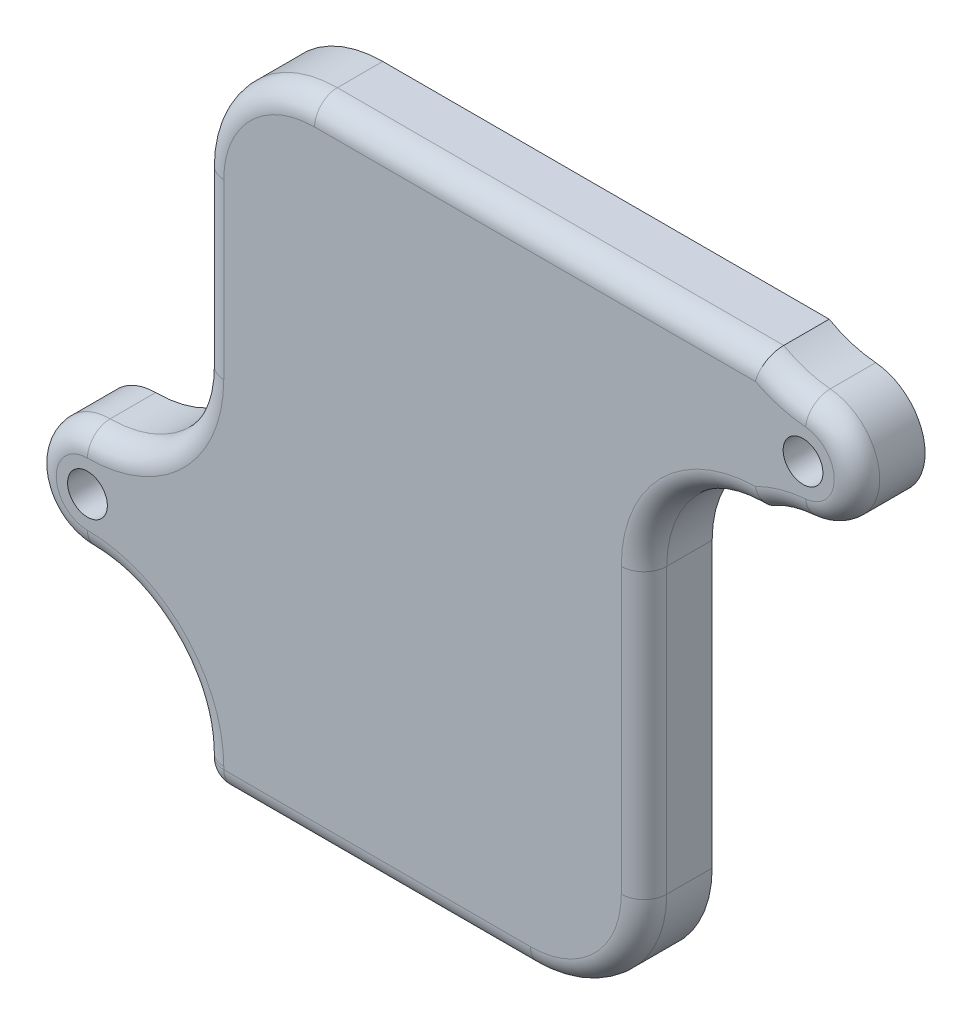
from build123d import *

# Parameters (mm, degrees)
SKETCH1_W           = 39
SKETCH1_H           = 57
BOSS_EXTRUDE1_DEPTH = 6
SKETCH2_R           = 4.75
SKETCH2_R_2         = 1.75
BOSS_EXTRUDE2_DEPTH = 6
FILLET4_R           = 10
SKETCH4_W           = 10.304705379
SKETCH4_H           = 12
BOSS_EXTRUDE3_DEPTH = 6
FILLET5_R           = 10
CUT_EXTRUDE2_DEPTH  = 3.5
FILLET7_R           = 2
FILLET8_R           = 2
FILLET9_R           = 2


with BuildPart() as part:
    # Sketch1 → Boss-Extrude1 (new body)
    with BuildSketch(Plane.XY):
        Rectangle(SKETCH1_W, SKETCH1_H)
    extrude(amount=BOSS_EXTRUDE1_DEPTH)

    # Sketch2 → Boss-Extrude2 (add)
    # profile 1 of 4: a face of its own
    with BuildSketch(Plane.XY.offset(6)):
        with BuildLine():
            ThreePointArc((33.5, 17.75), (28.75, 22.5), (33.5, 27.25))
            Line((33.5, 27.25), (19.5, 27.25))
            Line((19.5, 27.25), (19.5, 17.75))
            Line((19.5, 17.75), (33.5, 17.75))
        make_face()
    # profile 2 of 4: a face of its own
    with BuildSketch(Plane.XY.offset(6)):
        with BuildLine():
            Line((-19.5, -6.75), (-29.5, -6.75))
            ThreePointArc((-29.5, -6.75), (-26.141242789, -8.141242789), (-24.75, -11.5))
            ThreePointArc((-24.75, -11.5), (-26.141242789, -14.858757211), (-29.5, -16.25))
            Line((-29.5, -16.25), (-19.5, -16.25))
            Line((-19.5, -16.25), (-19.5, -6.75))
        make_face()
    # profile 3 of 4: a face of its own
    with BuildSketch(Plane.XY.offset(6)):
        with Locations((-29.5, -11.5)):
            Circle(SKETCH2_R)
        with Locations((-29.5, -11.5)):
            Circle(SKETCH2_R_2, mode=Mode.SUBTRACT)
    # profile 4 of 4: a face of its own
    with BuildSketch(Plane.XY.offset(6)):
        with Locations((33.5, 22.5)):
            Circle(SKETCH2_R)
        with Locations((33.5, 22.5)):
            Circle(SKETCH2_R_2, mode=Mode.SUBTRACT)
    extrude(amount=-BOSS_EXTRUDE2_DEPTH)

    # Fillet4
    fillet4_edges = [part.edges().sort_by_distance(p)[0] for p in [
        (-19.5, 28.5, 3),
        (19.5, -28.5, 3),
    ]]
    fillet(fillet4_edges, radius=FILLET4_R)

    # Sketch4 → Boss-Extrude3 (add)
    with BuildSketch(Plane.XY.offset(6)):
        with Locations((24.652352689, 22.5)):
            Rectangle(SKETCH4_W, SKETCH4_H)
    extrude(amount=-BOSS_EXTRUDE3_DEPTH)

    # Fillet5
    # the kernel refuses this fillet: 10 mm, written as the material it adds along each edge
    with BuildSketch(Plane(origin=(29.804705379, 17.75, 6), x_dir=(0, -1, 0), z_dir=(0, 0, -1))) as fillet5_piece_1:
        with BuildLine():
            CenterArc((9.947871925, -4.934270359), FILLET5_R, 150.433919307, 24.747651836)
            Line((-0.016787007, -4.094286808), (-1.0132529, -4.010288453))
            ThreePointArc((-1.0132529, -4.010288453), (-1, -3.695294621), (-1, 0))
            Line((-1, 0), (0, 1))
            ThreePointArc((0, 1), (0.625, 1), (0.380212808, 0.493427036))
            Line((0.380212808, 0.493427036), (1.25, 0))
        make_face()
    extrude(amount=6)
    with BuildSketch(Plane(origin=(29.804705379, 27.25, 0), x_dir=(0.9999915946740242, -0.004100070889875189, 0), z_dir=(0, 0, 1))) as fillet5_piece_2:
        with BuildLine():
            CenterArc((4.893441905, 9.968019168), FILLET5_R, 240.668836723, 24.747651836)
            Line((-0.005125089, 1.249989493), (-0.494981788, 0.378186526))
            ThreePointArc((-0.494981788, 0.378186526), (-1.002554139, 0.620894676), (-0.999991595, -0.004100071))
            Line((-0.999991595, -0.004100071), (0.004100071, -0.999991595))
            ThreePointArc((0.004100071, -0.999991595), (3.699363631, -0.984840625), (4.014409153, -0.996801917))
            Line((4.014409153, -0.996801917), (4.094321222, 0))
        make_face()
    extrude(amount=6)
    with BuildSketch(Plane(origin=(19.5, 16.5, 6), x_dir=(0, -1, 0), z_dir=(0, 0, -1)), Plane(origin=(-19.5, -6.75, 6), x_dir=(0, 1, 0), z_dir=(0, 0, -1)), Plane(origin=(-19.5, -16.25, 6), x_dir=(-1, 0, 0), z_dir=(0, 0, -1))) as fillet5_piece_3:
        with BuildLine():
            CenterArc((FILLET5_R, -FILLET5_R), FILLET5_R, 90, 90)
            Line((0, -FILLET5_R), (-FILLET5_R * 0.02, -FILLET5_R))
            Line((-FILLET5_R * 0.02, -FILLET5_R), (-FILLET5_R * 0.02, FILLET5_R * 0.02))
            Line((-FILLET5_R * 0.02, FILLET5_R * 0.02), (FILLET5_R, FILLET5_R * 0.02))
            Line((FILLET5_R, FILLET5_R * 0.02), (FILLET5_R, 0))
        make_face()
    extrude(amount=6)

    # Sketch5 → Cut-Extrude2 (cut)
    with BuildSketch(Plane(origin=(0, 0, 0), x_dir=(-1, 0, 0), z_dir=(0, 0, -1))):
        with BuildLine():
            Line((16.5, 3.25), (16.5, 18.5))
            ThreePointArc((16.5, 18.5), (14.449747468, 23.449747468), (9.5, 25.5))
            Line((9.5, 25.5), (-20.150604469, 25.5))
            Line((-20.150604469, 25.5), (-20.150604469, 15.532652058))
            ThreePointArc((-20.150604469, 15.532652058), (-17.447155068, 11.371234859), (-16.5, 6.5))
            Line((-16.5, 6.5), (-16.5, -18.5))
            ThreePointArc((-16.5, -18.5), (-14.449747468, -23.449747468), (-9.5, -25.5))
            Line((-9.5, -25.5), (16.521652648, -25.5))
            ThreePointArc((16.521652648, -25.5), (17.716131688, -20.759968343), (20.576715851, -16.796164799))
            Line((20.576715851, -16.796164799), (20.307611845, -5.942388155))
            ThreePointArc((20.307611845, -5.942388155), (17.489566077, -1.724884621), (16.5, 3.25))
        make_face()
    extrude(amount=-CUT_EXTRUDE2_DEPTH, mode=Mode.SUBTRACT)

    # Fillet7
    fillet7_edges = [part.edges().sort_by_distance(p)[0] for p in [
        (-19.5, -28.5, 3),
    ]]
    fillet(fillet7_edges, radius=FILLET7_R)

    # Fillet8
    # the kernel refuses this fillet: 2 mm, written as the material it takes off along each edge
    with BuildSketch(Plane(origin=(34.738975739, 7.802128075, 6), x_dir=(-0.8500291529283407, 0.5267356444858536, 0), z_dir=(-0.5267356444858536, -0.8500291529283407, 0))) as fillet8_piece_1:
        with BuildLine():
            CenterArc((10 + FILLET8_R, FILLET8_R), FILLET8_R, 180, 90)
            Line((10, FILLET8_R), (10, 0))
            Line((10, 0), (10 + FILLET8_R, 0))
        make_face()
    revolve(axis=Axis((34.738975739, 7.802128075, 6), (0, 0, -1)), revolution_arc=53.396411501, mode=Mode.SUBTRACT)
    with BuildSketch(Plane(origin=(34.738975739, 37.197871925, 6), x_dir=(-0.8500291529284019, -0.5267356444857548, 0), z_dir=(-0.5267356444857548, 0.8500291529284019, 0))) as fillet8_piece_2:
        with BuildLine():
            CenterArc((10 + FILLET8_R, -FILLET8_R), FILLET8_R, 90, 90)
            Line((10, -FILLET8_R), (10, 0))
            Line((10, 0), (10 + FILLET8_R, 0))
        make_face()
    revolve(axis=Axis((34.738975739, 37.197871925, 6), (0, 0, 1)), revolution_arc=53.396411501, mode=Mode.SUBTRACT)
    with BuildSketch(Plane(origin=(29.5, 6.5, 6), x_dir=(-1, 0, 0), z_dir=(0, -1, 0))) as fillet8_piece_3:
        with BuildLine():
            CenterArc((10 + FILLET8_R, FILLET8_R), FILLET8_R, 180, 90)
            Line((10, FILLET8_R), (10, 0))
            Line((10, 0), (10 + FILLET8_R, 0))
        make_face()
    revolve(axis=Axis((29.5, 6.5, 6), (0, 0, -1)), revolution_arc=90, mode=Mode.SUBTRACT)
    with BuildSketch(Plane(origin=(19.5, -18.5, 6), x_dir=(-1, 0, 0), z_dir=(0, 1, 0))) as fillet8_piece_4:
        with BuildLine():
            CenterArc((FILLET8_R, -FILLET8_R), FILLET8_R, 90, 90)
            Line((0, -FILLET8_R), (0, 0))
            Line((0, 0), (FILLET8_R, 0))
        make_face()
    extrude(amount=25, mode=Mode.SUBTRACT)
    with BuildSketch(Plane(origin=(9.5, -18.5, 6), x_dir=(0, -1, 0), z_dir=(-1, 0, 0))) as fillet8_piece_5:
        with BuildLine():
            CenterArc((10 - FILLET8_R, -FILLET8_R), FILLET8_R, 0, 90)
            Line((10, -FILLET8_R), (10, 0))
            Line((10, 0), (10 - FILLET8_R, 0))
        make_face()
    revolve(axis=Axis((9.5, -18.5, 6), (0, 0, 1)), revolution_arc=90, mode=Mode.SUBTRACT)
    with BuildSketch(Plane(origin=(-17.5, -28.5, 6), x_dir=(0, 1, 0), z_dir=(1, 0, 0))) as fillet8_piece_6:
        with BuildLine():
            CenterArc((FILLET8_R, -FILLET8_R), FILLET8_R, 90, 90)
            Line((0, -FILLET8_R), (0, 0))
            Line((0, 0), (FILLET8_R, 0))
        make_face()
    extrude(amount=27, mode=Mode.SUBTRACT)
    with BuildSketch(Plane(origin=(-17.5, -26.5, 6), x_dir=(-1, 0, 0), z_dir=(0, 1, 0))) as fillet8_piece_7:
        with BuildLine():
            CenterArc((2 - FILLET8_R, -FILLET8_R), FILLET8_R, 0, 90)
            Line((2, -FILLET8_R), (2, 0))
            Line((2, 0), (2 - FILLET8_R, 0))
        make_face()
    revolve(axis=Axis((-17.5, -26.5, 6), (0, 0, 1)), revolution_arc=90, mode=Mode.SUBTRACT)
    with BuildSketch(Plane(origin=(-19.5, -26.25, 6), x_dir=(1, 0, 0), z_dir=(0, -1, 0))) as fillet8_piece_8:
        with BuildLine():
            CenterArc((FILLET8_R, -FILLET8_R), FILLET8_R, 90, 90)
            Line((0, -FILLET8_R), (0, 0))
            Line((0, 0), (FILLET8_R, 0))
        make_face()
    extrude(amount=0.25, mode=Mode.SUBTRACT)
    with BuildSketch(Plane(origin=(-29.5, -26.25, 6), x_dir=(0, 1, 0), z_dir=(-1, 0, 0))) as fillet8_piece_9:
        with BuildLine():
            CenterArc((10 + FILLET8_R, FILLET8_R), FILLET8_R, 180, 90)
            Line((10, FILLET8_R), (10, 0))
            Line((10, 0), (10 + FILLET8_R, 0))
        make_face()
    revolve(axis=Axis((-29.5, -26.25, 6), (0, 0, -1)), revolution_arc=90, mode=Mode.SUBTRACT)
    with BuildSketch(Plane(origin=(-29.5, -11.5, 6), x_dir=(0, 1, 0), z_dir=(1, 0, 0))) as fillet8_piece_10:
        with BuildLine():
            CenterArc((4.75 - FILLET8_R, -FILLET8_R), FILLET8_R, 0, 90)
            Line((4.75, -FILLET8_R), (4.75, 0))
            Line((4.75, 0), (4.75 - FILLET8_R, 0))
        make_face()
    revolve(axis=Axis((-29.5, -11.5, 6), (0, 0, 1)), revolution_arc=180, mode=Mode.SUBTRACT)
    with BuildSketch(Plane(origin=(-29.5, 3.25, 6), x_dir=(1, 0, 0), z_dir=(0, 1, 0))) as fillet8_piece_11:
        with BuildLine():
            CenterArc((10 + FILLET8_R, FILLET8_R), FILLET8_R, 180, 90)
            Line((10, FILLET8_R), (10, 0))
            Line((10, 0), (10 + FILLET8_R, 0))
        make_face()
    revolve(axis=Axis((-29.5, 3.25, 6), (0, 0, -1)), revolution_arc=90, mode=Mode.SUBTRACT)
    with BuildSketch(Plane(origin=(-19.5, 18.5, 6), x_dir=(1, 0, 0), z_dir=(0, -1, 0))) as fillet8_piece_12:
        with BuildLine():
            CenterArc((FILLET8_R, -FILLET8_R), FILLET8_R, 90, 90)
            Line((0, -FILLET8_R), (0, 0))
            Line((0, 0), (FILLET8_R, 0))
        make_face()
    extrude(amount=15.25, mode=Mode.SUBTRACT)
    with BuildSketch(Plane(origin=(-9.5, 18.5, 6), x_dir=(0, 1, 0), z_dir=(1, 0, 0))) as fillet8_piece_13:
        with BuildLine():
            CenterArc((10 - FILLET8_R, -FILLET8_R), FILLET8_R, 0, 90)
            Line((10, -FILLET8_R), (10, 0))
            Line((10, 0), (10 - FILLET8_R, 0))
        make_face()
    revolve(axis=Axis((-9.5, 18.5, 6), (0, 0, 1)), revolution_arc=90, mode=Mode.SUBTRACT)
    with BuildSketch(Plane(origin=(33.5, 22.5, 6), x_dir=(0.08399835516458835, 0.9964658932094184, 0), z_dir=(-0.9964658932094184, 0.08399835516458835, 0))) as fillet8_piece_14:
        with BuildLine():
            CenterArc((4.75 - FILLET8_R, FILLET8_R), FILLET8_R, 270, 90)
            Line((4.75, FILLET8_R), (4.75, 0))
            Line((4.75, 0), (4.75 - FILLET8_R, 0))
        make_face()
    revolve(axis=Axis((33.5, 22.5, 6), (0, 0, -1)), revolution_arc=170.363142288, mode=Mode.SUBTRACT)
    with BuildSketch(Plane(origin=(-9.5, 28.5, 6), x_dir=(0, -1, 0), z_dir=(1, 0, 0))) as fillet8_piece_15:
        with BuildLine():
            CenterArc((FILLET8_R, FILLET8_R), FILLET8_R, 180, 90)
            Line((0, FILLET8_R), (0, 0))
            Line((0, 0), (FILLET8_R, 0))
        make_face()
    extrude(amount=44.304705379, mode=Mode.SUBTRACT)
    with BuildSketch(Plane(origin=(34.804705379, 16.5, 6), x_dir=(0, 1, 0), z_dir=(-1, 0, 0))) as fillet8_piece_16:
        with BuildLine():
            CenterArc((FILLET8_R, FILLET8_R), FILLET8_R, 180, 90)
            Line((0, FILLET8_R), (0, 0))
            Line((0, 0), (FILLET8_R, 0))
        make_face()
    extrude(amount=5.304705379, mode=Mode.SUBTRACT)

    # Fillet9
    fillet9_edges = [part.edges().sort_by_distance(p)[0] for p in [
        (-16.5, 10.875, 3.5),
        (-3.510826324, -25.5, 3.5),
        (14.449747468, -23.449747468, 3.5),
        (16.5, -6, 3.5),
        (5.325302234, 25.5, 3.5),
        (-14.449747468, 23.449747468, 3.5),
        (-17.489566077, -1.724884621, 3.5),
        (-20.442163848, -11.369276477, 3.5),
        (-17.716131688, -20.759968343, 3.5),
        (17.447155068, 11.371234859, 3.5),
        (20.150604469, 20.516326029, 3.5),
    ]]
    fillet(fillet9_edges, radius=FILLET9_R)


solid = part.part
